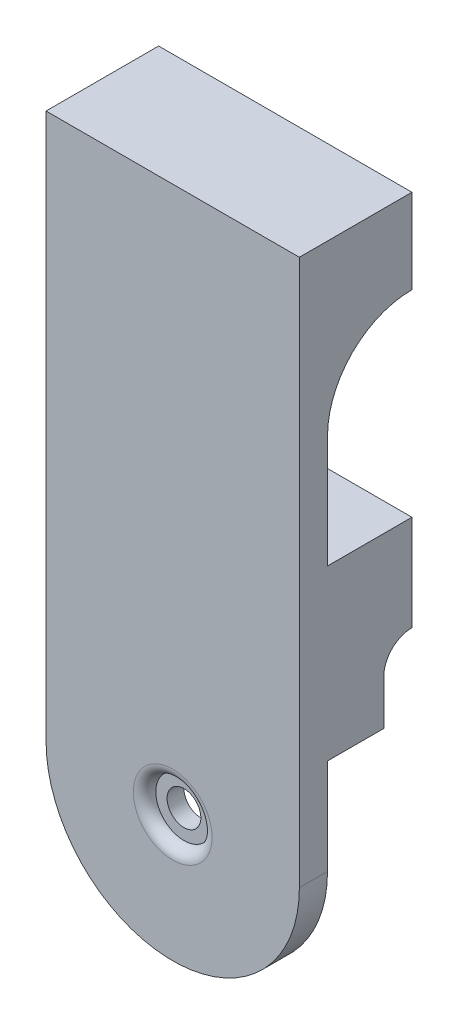
from build123d import *

# Parameters (mm, degrees)
ESBO_O2_R                = 3
RESSALTO_EXTRUS_O1_DEPTH = 5
ESBO_O11_R               = 5
CORTE_EXTRUS_O3_DEPTH    = 2
ESBO_O3_W                = 45
ESBO_O3_H                = 13
RESSALTO_EXTRUS_O2_DEPTH = 10
ESBO_O4_W                = 45
ESBO_O4_H                = 20
RESSALTO_EXTRUS_O3_DEPTH = 17
ESBO_O6_W                = 30.5
ESBO_O6_H                = 6.5
CORTE_EXTRUS_O1_DEPTH    = 15
ESBO_O7_W                = 45
ESBO_O7_H                = 5
RESSALTO_EXTRUS_O4_DEPTH = 50
ESBO_O8_W                = 45
ESBO_O8_H                = 15
RESSALTO_EXTRUS_O5_DEPTH = 15
ESBO_O9_W                = 35.5
ESBO_O9_H                = 5.5
CORTE_EXTRUS_O2_DEPTH    = 15
FILETE4_R                = 5
FILETE6_R                = 15
FILETE7_R                = 2


with BuildPart() as part:
    # Esboço2 → Ressalto-extrusão1 (new body)
    with BuildSketch(Plane.XY):
        with BuildLine():
            Line((-22.5, 0), (-22.5, 30))
            Line((-22.5, 30), (22.5, 30))
            Line((22.5, 30), (22.5, 0))
            ThreePointArc((22.5, 0), (0, -22.5), (-22.5, 0))
        make_face()
        Circle(ESBO_O2_R, mode=Mode.SUBTRACT)
    extrude(amount=RESSALTO_EXTRUS_O1_DEPTH)

    # Esboço11 → Corte-extrusão3 (cut)
    with BuildSketch(Plane.XY.offset(5)):
        Circle(ESBO_O11_R)
    extrude(amount=-CORTE_EXTRUS_O3_DEPTH, mode=Mode.SUBTRACT)

    # Esboço3 → Ressalto-extrusão2 (add)
    with BuildSketch(Plane(origin=(0, 0, 0), x_dir=(-1, 0, 0), z_dir=(0, 0, -1))):
        with Locations((0, 23.5)):
            Rectangle(ESBO_O3_W, ESBO_O3_H)
    extrude(amount=RESSALTO_EXTRUS_O2_DEPTH)

    # Esboço4 → Ressalto-extrusão3 (add)
    with BuildSketch(Plane(origin=(0, 30, 0), x_dir=(1, 0, 0), z_dir=(0, 1, 0))):
        with Locations((0, 5)):
            Rectangle(ESBO_O4_W, ESBO_O4_H)
    extrude(amount=RESSALTO_EXTRUS_O3_DEPTH)

    # Esboço6 → Corte-extrusão1 (cut)
    with BuildSketch(Plane(origin=(0, 0, -15), x_dir=(-1, 0, 0), z_dir=(0, 0, -1))):
        with Locations((0, 38.5)):
            Rectangle(ESBO_O6_W, ESBO_O6_H)
    extrude(amount=-CORTE_EXTRUS_O1_DEPTH, mode=Mode.SUBTRACT)

    # Esboço7 → Ressalto-extrusão4 (add)
    with BuildSketch(Plane(origin=(0, 47, 0), x_dir=(1, 0, 0), z_dir=(0, 1, 0))):
        with Locations((0, -2.5)):
            Rectangle(ESBO_O7_W, ESBO_O7_H)
    extrude(amount=RESSALTO_EXTRUS_O4_DEPTH)

    # Esboço8 → Ressalto-extrusão5 (add)
    with BuildSketch(Plane(origin=(0, 0, 0), x_dir=(-1, 0, 0), z_dir=(0, 0, -1))):
        with Locations((0, 89.5)):
            Rectangle(ESBO_O8_W, ESBO_O8_H)
    extrude(amount=RESSALTO_EXTRUS_O5_DEPTH)

    # Esboço9 → Corte-extrusão2 (cut)
    with BuildSketch(Plane(origin=(0, 0, -15), x_dir=(-1, 0, 0), z_dir=(0, 0, -1))):
        with Locations((0, 89.5)):
            Rectangle(ESBO_O9_W, ESBO_O9_H)
    extrude(amount=-CORTE_EXTRUS_O2_DEPTH, mode=Mode.SUBTRACT)

    # Filete4
    filete4_edges = [part.edges().sort_by_distance(p)[0] for p in [
        (0, 30, -10),
    ]]
    fillet(filete4_edges, radius=FILETE4_R - 0.0001)  # a hair under: the kernel refuses the full size

    # Filete6
    filete6_edges = [part.edges().sort_by_distance(p)[0] for p in [
        (0, 82, 0),
    ]]
    fillet(filete6_edges, radius=FILETE6_R - 0.0001)  # a hair under: the kernel refuses the full size

    # Filete7
    filete7_edges = [part.edges().sort_by_distance(p)[0] for p in [
        (-5, 0, 5),
    ]]
    fillet(filete7_edges, radius=FILETE7_R - 0.0001)  # a hair under: the kernel refuses the full size


solid = part.part
